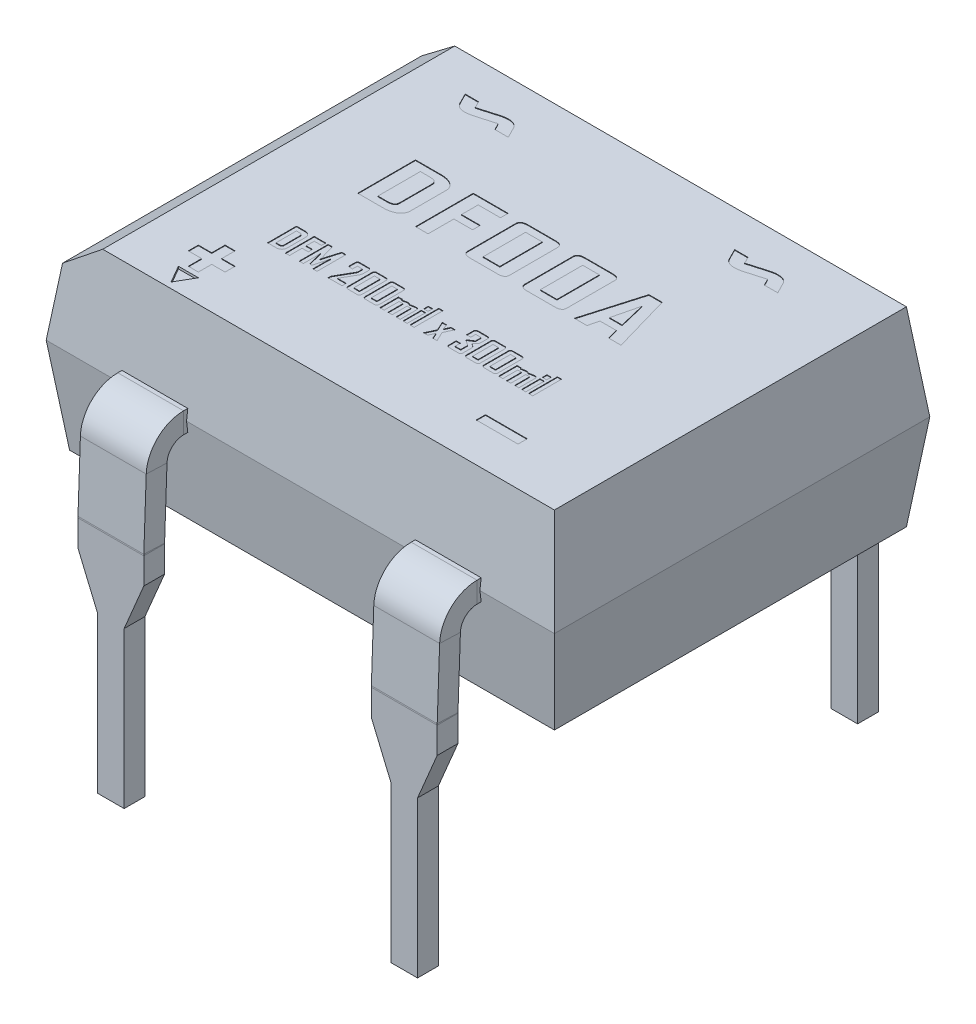
from build123d import *
from OCP.BRepFilletAPI import BRepFilletAPI_MakeChamfer

# Parameters (mm, degrees)
BODY_SKETCH_W                              = 8.8
BODY_SKETCH_H                              = 6.5
BODY_MAIN_DEPTH                            = 3.3
BODY_CHAMFER1_SIZE                         = 1.65
BODY_CHAMFER1_SIZE2                        = 0.202594525
BODY_CHAMFER2_SIZE                         = 0.202594525
BODY_CHAMFER2_SIZE_2                       = 1.65
BODY_CHAMFER_SIZE                          = 0.5
BODY_CHAMFER_SIZE2                         = 0.574265899
PIN_B1_SWEEP_START                         = -0.57
PIN_B1_SWEEP_DEPTH                         = 1.14
PIN_B1_CUT_REACH                           = 12.98
PIN_B_SKETCH_W                             = 0.46
PIN_B_SKETCH_H                             = 0.36
PIN_STRAIGHT_PATTERN_COUNT                 = 2
PIN_STRAIGHT_PATTERN_PITCH                 = 5.08
PIN_STRAIGHT_PATTERN_MIRROR_START          = -0.57
PIN_STRAIGHT_PATTERN_MIRROR_COPY_1_DEPTH   = 1.14
PIN_STRAIGHT_PATTERN_MIRROR_COPY_2_REACH   = 12.98
PIN_STRAIGHT_PATTERN_MIRROR_COPY_3_SKETC_W = 0.46
PIN_STRAIGHT_PATTERN_MIRROR_COPY_3_SKETC_H = 0.36
TEXT_START                                 = 4.56
TEXT_2_OUTLINE_W                           = 0.096385542
TEXT_2_OUTLINE_H                           = 0.355421687
TEXT_2_OUTLINE_W_2                         = 0.289156627
TEXT_2_OUTLINE_H_2                         = 0.73493976
TEXT_2_OUTLINE_W_3                         = 0.289156626
TEXT_2_OUTLINE_W_4                         = 0.072289156
TEXT_2_OUTLINE_H_3                         = 0.319277108
TEXT_2_OUTLINE_W_5                         = 0.072289157
TEXT_2_OUTLINE_H_4                         = 0.5
TEXT_2_OUTLINE_W_6                         = 0.073606928
TEXT_2_OUTLINE_H_5                         = 0.078313253
TEXT_2_OUTLINE_W_7                         = 0.073606927
TEXT_2_DEPTH                               = 0.01
SKETCH23_W                                 = 0.722891566
SKETCH23_H                                 = 0.159036145
TEXT1_DEPTH                                = 0.01
PIN1_MARK_DEPTH                            = 0.04


# Read off the part's stored shape, not the designer's step: PIN_B1_Sweep, text
with BuildPart() as part:
    # BODY_Sketch → BODY_MAIN (new body)
    with BuildSketch(Plane(origin=(0, 1.27, 0), x_dir=(1, 0, 0), z_dir=(0, 1, 0))):
        with Locations((2.54, 3.81)):
            Rectangle(BODY_SKETCH_W, BODY_SKETCH_H)
    extrude(amount=BODY_MAIN_DEPTH)

    # BODY_Chamfer1: one chamfer whose edges measure the first distance from different faces: ONE call of the kernel's chamfer builder (chamfer() names one face for all edges)
    body_chamfer1_edges_1 = [part.edges().sort_by_distance(p)[0] for p in [
        (6.94, 4.57, -3.81),
    ]]
    body_chamfer1_side_1 = [part.faces().sort_by_distance(p)[0] for p in [
        (6.94, 2.92, -3.81),
    ]]
    body_chamfer1_edges_2 = [part.edges().sort_by_distance(p)[0] for p in [
        (2.54, 4.57, -7.06),
    ]]
    body_chamfer1_side_2 = [part.faces().sort_by_distance(p)[0] for p in [
        (2.54, 2.92, -7.06),
    ]]
    body_chamfer1_edges_3 = [part.edges().sort_by_distance(p)[0] for p in [
        (-1.86, 4.57, -3.81),
    ]]
    body_chamfer1_side_3 = [part.faces().sort_by_distance(p)[0] for p in [
        (-1.86, 2.92, -3.81),
    ]]
    body_chamfer1_edges_4 = [part.edges().sort_by_distance(p)[0] for p in [
        (2.54, 4.57, -0.56),
    ]]
    body_chamfer1_side_4 = [part.faces().sort_by_distance(p)[0] for p in [
        (2.54, 2.92, -0.56),
    ]]
    body_chamfer1 = BRepFilletAPI_MakeChamfer(part.part.solid().wrapped)
    for e in body_chamfer1_edges_1:
        body_chamfer1.Add(BODY_CHAMFER1_SIZE, BODY_CHAMFER1_SIZE2, e.wrapped, body_chamfer1_side_1[0].wrapped)  # the first distance lies on this face
    for e in body_chamfer1_edges_2:
        body_chamfer1.Add(BODY_CHAMFER1_SIZE, BODY_CHAMFER1_SIZE2, e.wrapped, body_chamfer1_side_2[0].wrapped)  # the first distance lies on this face
    for e in body_chamfer1_edges_3:
        body_chamfer1.Add(BODY_CHAMFER1_SIZE, BODY_CHAMFER1_SIZE2, e.wrapped, body_chamfer1_side_3[0].wrapped)  # the first distance lies on this face
    for e in body_chamfer1_edges_4:
        body_chamfer1.Add(BODY_CHAMFER1_SIZE, BODY_CHAMFER1_SIZE2, e.wrapped, body_chamfer1_side_4[0].wrapped)  # the first distance lies on this face
    add(Compound.cast(body_chamfer1.Shape()), mode=Mode.REPLACE)

    # BODY_Chamfer2
    # the kernel refuses this chamfer: 1.65, 0.202594525 mm, written as the material it takes off along each edge
    with BuildSketch(Plane(origin=(11.228817255, 1.27, -0.56), x_dir=(0, -0.29696840376135814, -0.9548873060039237), z_dir=(-1, 0, 0))) as body_chamfer2_piece_1:
        Polygon((BODY_CHAMFER2_SIZE * 0.954887308312, -BODY_CHAMFER2_SIZE * 0.296968404479), (-BODY_CHAMFER2_SIZE_2 * 0.296968403761, -BODY_CHAMFER2_SIZE_2 * 0.954887306004), (0, 0), align=None)
    extrude(amount=17.37763451, mode=Mode.SUBTRACT)
    with BuildSketch(Plane(origin=(6.94, 1.27, -11.348817255), x_dir=(-0.9548873060039239, -0.2969684037613571, 0), z_dir=(0, 0, 1))) as body_chamfer2_piece_2:
        Polygon((BODY_CHAMFER2_SIZE * 0.954887308312, -BODY_CHAMFER2_SIZE * 0.296968404479), (-BODY_CHAMFER2_SIZE_2 * 0.296968403761, -BODY_CHAMFER2_SIZE_2 * 0.954887306004), (0, 0), align=None)
    extrude(amount=15.07763451, mode=Mode.SUBTRACT)
    with BuildSketch(Plane(origin=(-6.148817255, 1.27, -7.06), x_dir=(0, 0.9999890085715017, -0.004688575069791045), z_dir=(1, 0, 0))) as body_chamfer2_piece_3:
        Polygon((BODY_CHAMFER2_SIZE_2 * 0.999989008572, BODY_CHAMFER2_SIZE_2 * 0.00468857506979), (-BODY_CHAMFER2_SIZE * 0.00468857508113, BODY_CHAMFER2_SIZE * 0.999989010989), (0, 0), align=None)
    extrude(amount=17.37763451, mode=Mode.SUBTRACT)
    with BuildSketch(Plane(origin=(-1.86, 1.27, 3.728817255), x_dir=(-0.004688575069790786, 0.9999890085715017, 0), z_dir=(0, 0, -1))) as body_chamfer2_piece_4:
        Polygon((BODY_CHAMFER2_SIZE_2 * 0.999989008572, BODY_CHAMFER2_SIZE_2 * 0.00468857506979), (-BODY_CHAMFER2_SIZE * 0.00468857508113, BODY_CHAMFER2_SIZE * 0.999989010989), (0, 0), align=None)
    extrude(amount=15.07763451, mode=Mode.SUBTRACT)

    # BODY_Chamfer
    body_chamfer_edges = [part.edges().sort_by_distance(p)[0] for p in [
        (-1.657405475, 4.57, -3.81),
    ]]
    body_chamfer_side = [part.faces().sort_by_distance(p)[0] for p in [
        (-1.759789019, 3.736152945, -3.81),
    ]]
    chamfer(body_chamfer_edges, length=BODY_CHAMFER_SIZE, length2=BODY_CHAMFER_SIZE2, reference=body_chamfer_side[0])

    # PIN_B1_Sweep outline → PIN_B1_Sweep (add)
    with BuildSketch(Plane.YZ.offset(PIN_B1_SWEEP_START)):
        with BuildLine():
            Line((0.01, 0.18), (0.01, -0.18))
            Line((0.01, -0.18), (1.27, -0.18))
            ThreePointArc((1.27, -0.18), (1.27511433, -0.180045414), (1.280227048, -0.180181642))
            Line((1.280227048, -0.180181642), (2.462227048, -0.222181642))
            ThreePointArc((2.462227048, -0.222181642), (2.659231018, -0.310001737), (2.74, -0.51))
            Line((2.74, -0.51), (2.74, -0.582101221))
            Line((2.74, -0.582101221), (2.92, -0.56))
            Line((2.92, -0.56), (3.1, -0.582101221))
            Line((3.1, -0.582101221), (3.1, -0.51))
            ThreePointArc((3.1, -0.51), (2.918269791, -0.060003909), (2.475010859, 0.137591307))
            Line((2.475010859, 0.137591307), (1.293010859, 0.179591307))
            ThreePointArc((1.293010859, 0.179591307), (1.281507244, 0.179897819), (1.27, 0.18))
            Line((1.27, 0.18), (0.01, 0.18))
        make_face()
    pin_b1_sweep = extrude(amount=PIN_B1_SWEEP_DEPTH)

    # Sketch22 → PIN_B1_Cut (cut, up to next)
    with BuildSketch(Plane(origin=(0, 0.099888998, 0.18), x_dir=(1, 0, 0), z_dir=(0, 0, 1)), mode=Mode.PRIVATE) as pin_b1_cut_sk1:
        Polygon((-0.23, -0.089888998), (-0.67, 0.954152422), (-0.67, -0.089888998), align=None)
    pin_b1_cut_tool1 = extrude(pin_b1_cut_sk1.sketch, amount=-PIN_B1_CUT_REACH, mode=Mode.PRIVATE) & part.part
    # Sketch22 → PIN_B1_Cut (cut, up to next)
    with BuildSketch(Plane(origin=(0, 0.099888998, 0.18), x_dir=(1, 0, 0), z_dir=(0, 0, 1)), mode=Mode.PRIVATE) as pin_b1_cut_sk2:
        Polygon((0.67, -0.089888998), (0.23, -0.089888998), (0.67, 0.954152422), align=None)
    pin_b1_cut_tool2 = extrude(pin_b1_cut_sk2.sketch, amount=-PIN_B1_CUT_REACH, mode=Mode.PRIVATE) & part.part
    pin_b1_cut_1 = pin_b1_cut_tool1.solids().sort_by_distance((-0.523333, 0.358014, 0.18))[0]
    add(pin_b1_cut_1, mode=Mode.SUBTRACT)
    pin_b1_cut_2 = pin_b1_cut_tool2.solids().sort_by_distance((0.523333, 0.358014, 0.18))[0]
    add(pin_b1_cut_2, mode=Mode.SUBTRACT)
    pin_b1_cut = pin_b1_cut_1 + pin_b1_cut_2  # PIN_B1_Cut as one shape, for the pattern or mirror that repeats it

    # PIN_straight: sweep along a path in PIN_B_Path
    with BuildLine(Plane(origin=(0, 0, 0), x_dir=(0, 0, -1), z_dir=(1, 0, 0))) as pin_straight_path:
        Line((0, 0.01), (0, -2.69))
    # PIN_B_Sketch → PIN_straight (sweep)
    with BuildSketch(Plane.XZ.offset(-0.01)):
        Rectangle(PIN_B_SKETCH_W, PIN_B_SKETCH_H)
    pin_straight = sweep(path=pin_straight_path.line)

    # PIN_straight_Pattern: PIN_B1_Sweep, PIN_B1_Cut, PIN_straight ×2
    with Locations(*[(i * PIN_STRAIGHT_PATTERN_PITCH, 0, 0) for i in range(1, PIN_STRAIGHT_PATTERN_COUNT)]):
        add(pin_b1_sweep)
        add(pin_b1_cut, mode=Mode.SUBTRACT)
        add(pin_straight)

    # PIN_straight_Pattern_Mirror: PIN_B1_Sweep, PIN_B1_Cut, PIN_straight across plane
    add(pin_b1_sweep.mirror(Plane.XY.offset(-3.81)))
    add(pin_b1_cut.mirror(Plane.XY.offset(-3.81)), mode=Mode.SUBTRACT)
    add(pin_straight.mirror(Plane.XY.offset(-3.81)))

    # PIN_straight_Pattern_Mirror copy 1 sketc → PIN_straight_Pattern_Mirror copy 1 (add)
    with BuildSketch(Plane(origin=(5.08, 0, -7.62), x_dir=(0, 1, 0), z_dir=(1, 0, 0)).offset(PIN_STRAIGHT_PATTERN_MIRROR_START)):
        with BuildLine():
            Line((0.01, -0.18), (0.01, 0.18))
            Line((0.01, 0.18), (1.27, 0.18))
            ThreePointArc((1.27, 0.18), (1.27511433, 0.180045414), (1.280227048, 0.180181642))
            Line((1.280227048, 0.180181642), (2.462227048, 0.222181642))
            ThreePointArc((2.462227048, 0.222181642), (2.659231018, 0.310001737), (2.74, 0.51))
            Line((2.74, 0.51), (2.74, 0.582101221))
            Line((2.74, 0.582101221), (2.92, 0.56))
            Line((2.92, 0.56), (3.1, 0.582101221))
            Line((3.1, 0.582101221), (3.1, 0.51))
            ThreePointArc((3.1, 0.51), (2.918269791, 0.060003909), (2.475010859, -0.137591307))
            Line((2.475010859, -0.137591307), (1.293010859, -0.179591307))
            ThreePointArc((1.293010859, -0.179591307), (1.281507244, -0.179897819), (1.27, -0.18))
            Line((1.27, -0.18), (0.01, -0.18))
        make_face()
    extrude(amount=PIN_STRAIGHT_PATTERN_MIRROR_COPY_1_DEPTH)

    # PIN_straight_Pattern_Mirror copy 2 sketc → PIN_straight_Pattern_Mirror copy 2 (cut, up to next)
    with BuildSketch(Plane(origin=(5.08, 0.099888998, -7.8), x_dir=(1, 0, 0), z_dir=(0, 0, -1)), mode=Mode.PRIVATE) as pin_straight_pattern_mirror_copy_2_sk1:
        Polygon((-0.23, 0.089888998), (-0.67, -0.954152422), (-0.67, 0.089888998), align=None)
    pin_straight_pattern_mirror_copy_2_tool1 = extrude(pin_straight_pattern_mirror_copy_2_sk1.sketch, amount=-PIN_STRAIGHT_PATTERN_MIRROR_COPY_2_REACH, mode=Mode.PRIVATE) & part.part
    # PIN_straight_Pattern_Mirror copy 2 sketc → PIN_straight_Pattern_Mirror copy 2 (cut, up to next)
    with BuildSketch(Plane(origin=(5.08, 0.099888998, -7.8), x_dir=(1, 0, 0), z_dir=(0, 0, -1)), mode=Mode.PRIVATE) as pin_straight_pattern_mirror_copy_2_sk2:
        Polygon((0.67, 0.089888998), (0.23, 0.089888998), (0.67, -0.954152422), align=None)
    pin_straight_pattern_mirror_copy_2_tool2 = extrude(pin_straight_pattern_mirror_copy_2_sk2.sketch, amount=-PIN_STRAIGHT_PATTERN_MIRROR_COPY_2_REACH, mode=Mode.PRIVATE) & part.part
    add(pin_straight_pattern_mirror_copy_2_tool1.solids().sort_by_distance((4.556667, 0.358014, -7.8))[0], mode=Mode.SUBTRACT)
    add(pin_straight_pattern_mirror_copy_2_tool2.solids().sort_by_distance((5.603333, 0.358014, -7.8))[0], mode=Mode.SUBTRACT)

    # PIN_straight_Pattern_Mirror copy 3: sweep along a path in PIN_straight_Pattern_Mirror copy 3 path
    with BuildLine(Plane(origin=(5.08, 0, -7.62), x_dir=(0, 0, 1), z_dir=(1, 0, 0))) as pin_straight_pattern_mirror_copy_3_path:
        Line((0, -0.01), (0, 2.69))
    # PIN_straight_Pattern_Mirror copy 3 sketc → PIN_straight_Pattern_Mirror copy 3 (sweep)
    with BuildSketch(Plane(origin=(5.08, 0.01, -7.62), x_dir=(1, 0, 0), z_dir=(0, -1, 0))):
        Rectangle(PIN_STRAIGHT_PATTERN_MIRROR_COPY_3_SKETC_W, PIN_STRAIGHT_PATTERN_MIRROR_COPY_3_SKETC_H)
    sweep(path=pin_straight_pattern_mirror_copy_3_path.line)

    # text 2 outline → text 2 (cut)
    # profile 1 of 23: a face of its own
    with BuildSketch(Plane(origin=(0, 0, 0), x_dir=(1, 0, 0), z_dir=(0, 1, 0)).offset(TEXT_START)):
        with BuildLine():
            add(Edge.make_bspline(
                [(1.00746988, 4.002771084), (1.00727965, 3.995663386), (1.006906731, 3.981729721), (1.00317158, 3.961369018), (0.997257124, 3.942069177), (0.988493865, 3.923983479), (0.977882575, 3.906738605), (0.964407588, 3.890821192), (0.948747474, 3.87593042), (0.930816326, 3.862302098), (0.911153939, 3.849767265), (0.889500976, 3.839471181), (0.866749783, 3.829996674), (0.842272775, 3.822856561), (0.816473446, 3.816847302), (0.789045864, 3.813186314), (0.760229918, 3.810276646), (0.740472688, 3.810093652), (0.730361446, 3.81)],
                knots=[0, 0, 0, 0, 0.056495464, 0.110751584, 0.164123021, 0.216604362, 0.270213453, 0.324803911, 0.382011829, 0.44182685, 0.503744729, 0.567156209, 0.632331663, 0.699614706, 0.769742039, 0.842889516, 0.919594889, 1, 1, 1, 1], degree=3))
            Line((1.00746988, 4.002771084), (1.00746988, 4.617228916))
            add(Edge.make_bspline(
                [(0.730361446, 4.81), (0.740471168, 4.809897591), (0.760225426, 4.809697486), (0.789071712, 4.806908855), (0.816419765, 4.802815582), (0.842342516, 4.797284539), (0.866701964, 4.789725064), (0.889560961, 4.780407473), (0.911100603, 4.769810429), (0.930827976, 4.757339937), (0.948730267, 4.743677753), (0.964496894, 4.72881004), (0.977685611, 4.712749031), (0.988673159, 4.695745528), (0.99714848, 4.67763104), (1.003218162, 4.658397882), (1.006885969, 4.638140232), (1.007273205, 4.624272342), (1.00746988, 4.617228916)],
                knots=[0, 0, 0, 0, 0.080457372, 0.157212601, 0.230480895, 0.300545247, 0.36801829, 0.433236106, 0.496910647, 0.558868771, 0.618722669, 0.675967771, 0.73097843, 0.783778264, 0.836745638, 0.889675303, 0.943966688, 1, 1, 1, 1], degree=3))
            Line((0.730361446, 4.81), (0.284578313, 4.81))
            Line((0.284578313, 4.81), (0.284578313, 3.81))
            Line((0.284578313, 3.81), (0.730361446, 3.81))
        make_face()
        with BuildLine():
            add(Edge.make_bspline(
                [(0.657695783, 3.94253012), (0.668063216, 3.942752359), (0.687566079, 3.943170426), (0.7147746, 3.946996071), (0.738004617, 3.953460748), (0.757166303, 3.962570736), (0.772428504, 3.974474531), (0.783047639, 3.989475426), (0.789611002, 4.007155894), (0.790261483, 4.019841986), (0.79060241, 4.026490964)],
                knots=[0, 0, 0, 0, 0.175147659, 0.329481845, 0.463068675, 0.581170952, 0.686015021, 0.786369893, 0.888033156, 1, 1, 1, 1], degree=3))
            Line((0.657695783, 3.94253012), (0.501445783, 3.94253012))
            Line((0.501445783, 3.94253012), (0.501445783, 4.67746988))
            Line((0.501445783, 4.67746988), (0.66315512, 4.67746988))
            add(Edge.make_bspline(
                [(0.79060241, 4.594638554), (0.790206584, 4.601144228), (0.789447018, 4.61362824), (0.783581123, 4.631196527), (0.773071586, 4.645834918), (0.758671488, 4.657749996), (0.740191612, 4.666726383), (0.717999514, 4.673194022), (0.691821362, 4.676783029), (0.673143617, 4.677230552), (0.66315512, 4.67746988)],
                knots=[0, 0, 0, 0, 0.11341682, 0.217640324, 0.318193179, 0.423895753, 0.540435318, 0.674148639, 0.825741007, 1, 1, 1, 1], degree=3))
            Line((0.79060241, 4.594638554), (0.79060241, 4.026490964))
        make_face(mode=Mode.SUBTRACT)
    # profile 2 of 23: a face of its own
    with BuildSketch(Plane(origin=(0, 0, 0), x_dir=(1, 0, 0), z_dir=(0, 1, 0)).offset(TEXT_START)):
        with BuildLine():
            add(Edge.make_bspline(
                [(3.892409639, 2.325736269), (3.89219699, 2.322740065), (3.891795344, 2.317080916), (3.889664259, 2.309191369), (3.886537296, 2.302330064), (3.881927287, 2.296779615), (3.876376838, 2.292169605), (3.869515532, 2.289042642), (3.861625986, 2.286911557), (3.855966836, 2.286509912), (3.852970633, 2.286297263)],
                knots=[0, 0, 0, 0, 0.143087679, 0.270260174, 0.38817721, 0.5, 0.61182279, 0.729739826, 0.856912321, 1, 1, 1, 1], degree=3))
            Line((3.892409639, 2.325736269), (3.892409639, 2.746858257))
            add(Edge.make_bspline(
                [(3.852970633, 2.786297263), (3.855966836, 2.786084614), (3.861625986, 2.785682968), (3.869515532, 2.783551883), (3.876376838, 2.780424921), (3.881927287, 2.775814911), (3.886537296, 2.770264462), (3.889664259, 2.763403156), (3.891795344, 2.75551361), (3.89219699, 2.74985446), (3.892409639, 2.746858257)],
                knots=[0, 0, 0, 0, 0.143087679, 0.270260174, 0.38817721, 0.5, 0.61182279, 0.729739826, 0.856912321, 1, 1, 1, 1], degree=3))
            Line((3.852970633, 2.786297263), (3.691920181, 2.786297263))
            add(Edge.make_bspline(
                [(3.651445783, 2.746858257), (3.651649223, 2.749856632), (3.652034038, 2.755528188), (3.65429028, 2.763411133), (3.657508196, 2.770274575), (3.662216952, 2.77581752), (3.667879218, 2.780452518), (3.674940455, 2.78356486), (3.683050815, 2.785670101), (3.688862192, 2.786081029), (3.691920181, 2.786297263)],
                knots=[0, 0, 0, 0, 0.141223278, 0.267129934, 0.384156657, 0.495459119, 0.606977379, 0.726031612, 0.85583585, 1, 1, 1, 1], degree=3))
            Line((3.651445783, 2.746858257), (3.651445783, 2.325736269))
            add(Edge.make_bspline(
                [(3.690884789, 2.286297263), (3.687888585, 2.286509912), (3.682229436, 2.286911557), (3.67433989, 2.289042642), (3.667478584, 2.292169605), (3.661928135, 2.296779615), (3.657318125, 2.302330064), (3.654191163, 2.309191369), (3.652060078, 2.317080916), (3.651658432, 2.322740065), (3.651445783, 2.325736269)],
                knots=[0, 0, 0, 0, 0.143087679, 0.270260174, 0.38817721, 0.5, 0.61182279, 0.729739826, 0.856912321, 1, 1, 1, 1], degree=3))
            Line((3.690884789, 2.286297263), (3.852970633, 2.286297263))
        make_face()
        with Locations((3.771927711, 2.536297263)):
            Rectangle(TEXT_2_OUTLINE_W, TEXT_2_OUTLINE_H, mode=Mode.SUBTRACT)
    # profile 3 of 23: a face of its own
    with BuildSketch(Plane(origin=(0, 0, 0), x_dir=(1, 0, 0), z_dir=(0, 1, 0)).offset(TEXT_START)):
        with BuildLine():
            add(Edge.make_bspline(
                [(4.193614458, 2.325736269), (4.193401809, 2.322740065), (4.193000163, 2.317080916), (4.190869078, 2.309191369), (4.187742116, 2.302330064), (4.183132106, 2.296779615), (4.177581657, 2.292169605), (4.170720351, 2.289042642), (4.162830805, 2.286911557), (4.157171656, 2.286509912), (4.154175452, 2.286297263)],
                knots=[0, 0, 0, 0, 0.143087679, 0.270260174, 0.38817721, 0.5, 0.61182279, 0.729739826, 0.856912321, 1, 1, 1, 1], degree=3))
            Line((4.193614458, 2.325736269), (4.193614458, 2.746858257))
            add(Edge.make_bspline(
                [(4.154175452, 2.786297263), (4.157171656, 2.786084614), (4.162830805, 2.785682968), (4.170720351, 2.783551883), (4.177581657, 2.780424921), (4.183132106, 2.775814911), (4.187742116, 2.770264462), (4.190869078, 2.763403156), (4.193000163, 2.75551361), (4.193401809, 2.74985446), (4.193614458, 2.746858257)],
                knots=[0, 0, 0, 0, 0.143087679, 0.270260174, 0.38817721, 0.5, 0.61182279, 0.729739826, 0.856912321, 1, 1, 1, 1], degree=3))
            Line((4.154175452, 2.786297263), (3.993125, 2.786297263))
            add(Edge.make_bspline(
                [(3.952650602, 2.746858257), (3.952854042, 2.749856632), (3.953238858, 2.755528188), (3.955495099, 2.763411133), (3.958713015, 2.770274575), (3.963421771, 2.77581752), (3.969084037, 2.780452518), (3.976145275, 2.78356486), (3.984255634, 2.785670101), (3.990067011, 2.786081029), (3.993125, 2.786297263)],
                knots=[0, 0, 0, 0, 0.141223278, 0.267129934, 0.384156657, 0.495459119, 0.606977379, 0.726031612, 0.85583585, 1, 1, 1, 1], degree=3))
            Line((3.952650602, 2.746858257), (3.952650602, 2.325736269))
            add(Edge.make_bspline(
                [(3.992089608, 2.286297263), (3.989093405, 2.286509912), (3.983434255, 2.286911557), (3.975544709, 2.289042642), (3.968683403, 2.292169605), (3.963132954, 2.296779615), (3.958522945, 2.302330064), (3.955395982, 2.309191369), (3.953264897, 2.317080916), (3.952863251, 2.322740065), (3.952650602, 2.325736269)],
                knots=[0, 0, 0, 0, 0.143087679, 0.270260174, 0.38817721, 0.5, 0.61182279, 0.729739826, 0.856912321, 1, 1, 1, 1], degree=3))
            Line((3.992089608, 2.286297263), (4.154175452, 2.286297263))
        make_face()
        with Locations((4.07313253, 2.536297263)):
            Rectangle(TEXT_2_OUTLINE_W, TEXT_2_OUTLINE_H, mode=Mode.SUBTRACT)
    # profile 4 of 23: a face of its own
    with BuildSketch(Plane(origin=(0, 0, 0), x_dir=(1, 0, 0), z_dir=(0, 1, 0)).offset(TEXT_START)):
        with BuildLine():
            add(Edge.make_bspline(
                [(4.320120482, 2.589008106), (4.328121599, 2.590763482), (4.344093901, 2.594267667), (4.360061857, 2.597791607), (4.368030873, 2.599550275)],
                knots=[0, 0, 0, 0, 0.500936953, 1, 1, 1, 1], degree=3))
            Line((4.320120482, 2.589008106), (4.320120482, 2.605574371))
            Line((4.320120482, 2.605574371), (4.247831325, 2.605574371))
            Line((4.247831325, 2.605574371), (4.247831325, 2.286297263))
            Line((4.247831325, 2.286297263), (4.320120482, 2.286297263))
            Line((4.320120482, 2.286297263), (4.320120482, 2.544580395))
            Line((4.320120482, 2.544580395), (4.386385542, 2.545333407))
            Line((4.386385542, 2.545333407), (4.386385542, 2.286297263))
            Line((4.386385542, 2.286297263), (4.458674699, 2.286297263))
            Line((4.458674699, 2.286297263), (4.458674699, 2.544580395))
            Line((4.458674699, 2.544580395), (4.524939759, 2.545333407))
            Line((4.524939759, 2.545333407), (4.524939759, 2.286297263))
            Line((4.524939759, 2.286297263), (4.597228916, 2.286297263))
            Line((4.597228916, 2.286297263), (4.597228916, 2.566135365))
            add(Edge.make_bspline(
                [(4.555060241, 2.605574371), (4.558302555, 2.605424039), (4.564445324, 2.605139226), (4.573037835, 2.603188079), (4.580364374, 2.59995643), (4.586465373, 2.595582266), (4.591258254, 2.589898854), (4.594631855, 2.582982184), (4.596702683, 2.574909584), (4.597047491, 2.56916037), (4.597228916, 2.566135365)],
                knots=[0, 0, 0, 0, 0.148290832, 0.280946377, 0.400455298, 0.512425211, 0.621411208, 0.736958176, 0.861597969, 1, 1, 1, 1], degree=3))
            add(Edge.make_bspline(
                [(4.503196536, 2.598420757), (4.508492417, 2.599492064), (4.518429967, 2.601502338), (4.532394128, 2.603778123), (4.544394919, 2.605207154), (4.551731522, 2.60545976), (4.555060241, 2.605574371)],
                knots=[0, 0, 0, 0, 0.309141697, 0.580094407, 0.809483008, 1, 1, 1, 1], degree=3))
            add(Edge.make_bspline(
                [(4.451991717, 2.587690335), (4.460528998, 2.589432357), (4.477616171, 2.592918976), (4.494665553, 2.596585928), (4.503196536, 2.598420757)],
                knots=[0, 0, 0, 0, 0.499630991, 1, 1, 1, 1], degree=3))
            add(Edge.make_bspline(
                [(4.416506024, 2.605574371), (4.418705136, 2.60552566), (4.422901708, 2.605432704), (4.428903765, 2.604583893), (4.434265507, 2.603174599), (4.439101401, 2.60132216), (4.443284232, 2.598735824), (4.446869791, 2.595620963), (4.449935465, 2.591978881), (4.451297409, 2.589138393), (4.451991717, 2.587690335)],
                knots=[0, 0, 0, 0, 0.156222728, 0.298120382, 0.429540729, 0.5496141, 0.664719661, 0.776938378, 0.886284968, 1, 1, 1, 1], degree=3))
            add(Edge.make_bspline(
                [(4.368030873, 2.599550275), (4.372667227, 2.600470571), (4.38153478, 2.60223074), (4.394288656, 2.604086271), (4.405814195, 2.605321613), (4.413083446, 2.60549346), (4.416506024, 2.605574371)],
                knots=[0, 0, 0, 0, 0.289803378, 0.554281819, 0.790142707, 1, 1, 1, 1], degree=3))
        make_face()
    # profile 5 of 23: a face of its own
    with BuildSketch(Plane(origin=(0, 0, 0), x_dir=(1, 0, 0), z_dir=(0, 1, 0)).offset(TEXT_START)):
        with BuildLine():
            add(Edge.make_bspline(
                [(2.829156627, 3.888878012), (2.828646766, 3.882852243), (2.827668852, 3.871294821), (2.821259099, 3.855326841), (2.811720935, 3.841493213), (2.79812027, 3.830496657), (2.781438069, 3.821510148), (2.761151229, 3.8153725), (2.737575188, 3.811226258), (2.720680382, 3.810426002), (2.711686747, 3.81)],
                knots=[0, 0, 0, 0, 0.114098337, 0.218840581, 0.322174175, 0.429434412, 0.547100708, 0.679564678, 0.829422238, 1, 1, 1, 1], degree=3))
            Line((2.829156627, 3.888878012), (2.829156627, 4.731121988))
            add(Edge.make_bspline(
                [(2.711686747, 4.81), (2.720680382, 4.809573998), (2.737575188, 4.808773742), (2.761151229, 4.8046275), (2.781438069, 4.798489852), (2.79812027, 4.789503343), (2.811720935, 4.778506787), (2.821259099, 4.764673159), (2.827668852, 4.748705179), (2.828646766, 4.737147757), (2.829156627, 4.731121988)],
                knots=[0, 0, 0, 0, 0.170577762, 0.320435322, 0.452899292, 0.570565588, 0.677825825, 0.781159419, 0.885901663, 1, 1, 1, 1], degree=3))
            Line((2.711686747, 4.81), (2.226558735, 4.81))
            add(Edge.make_bspline(
                [(2.10626506, 4.731121988), (2.106757854, 4.737154091), (2.107704926, 4.748746842), (2.114377579, 4.764683097), (2.124096299, 4.778582684), (2.138089706, 4.789496459), (2.155125555, 4.798486553), (2.1759007, 4.804672818), (2.200050899, 4.808747761), (2.217378495, 4.809566322), (2.226558735, 4.81)],
                knots=[0, 0, 0, 0, 0.112348161, 0.215915455, 0.318343111, 0.425762474, 0.543690884, 0.676356302, 0.828532073, 1, 1, 1, 1], degree=3))
            Line((2.10626506, 4.731121988), (2.10626506, 3.888878012))
            add(Edge.make_bspline(
                [(2.22373494, 3.81), (2.214741305, 3.810426002), (2.197846499, 3.811226258), (2.174270458, 3.8153725), (2.153983618, 3.821510148), (2.137301417, 3.830496657), (2.123700751, 3.841493213), (2.114162588, 3.855326841), (2.107752834, 3.871294821), (2.106774921, 3.882852243), (2.10626506, 3.888878012)],
                knots=[0, 0, 0, 0, 0.170577762, 0.320435322, 0.452899292, 0.570565588, 0.677825825, 0.781159419, 0.885901663, 1, 1, 1, 1], degree=3))
            Line((2.22373494, 3.81), (2.711686747, 3.81))
        make_face()
        with Locations((2.467710843, 4.31)):
            Rectangle(TEXT_2_OUTLINE_W_2, TEXT_2_OUTLINE_H_2, mode=Mode.SUBTRACT)
    # profile 6 of 23: a face of its own
    with BuildSketch(Plane(origin=(0, 0, 0), x_dir=(1, 0, 0), z_dir=(0, 1, 0)).offset(TEXT_START)):
        with BuildLine():
            add(Edge.make_bspline(
                [(3.818313253, 3.888878012), (3.817803392, 3.882852243), (3.816825479, 3.871294821), (3.810415725, 3.855326841), (3.800877562, 3.841493213), (3.787276896, 3.830496657), (3.770594696, 3.821510148), (3.750307856, 3.8153725), (3.726731814, 3.811226258), (3.709837008, 3.810426002), (3.700843373, 3.81)],
                knots=[0, 0, 0, 0, 0.114098337, 0.218840581, 0.322174175, 0.429434412, 0.547100708, 0.679564678, 0.829422238, 1, 1, 1, 1], degree=3))
            Line((3.818313253, 3.888878012), (3.818313253, 4.731121988))
            add(Edge.make_bspline(
                [(3.700843373, 4.81), (3.709837008, 4.809573998), (3.726731814, 4.808773742), (3.750307856, 4.8046275), (3.770594696, 4.798489852), (3.787276896, 4.789503343), (3.800877562, 4.778506787), (3.810415725, 4.764673159), (3.816825479, 4.748705179), (3.817803392, 4.737147757), (3.818313253, 4.731121988)],
                knots=[0, 0, 0, 0, 0.170577762, 0.320435322, 0.452899292, 0.570565588, 0.677825825, 0.781159419, 0.885901663, 1, 1, 1, 1], degree=3))
            Line((3.700843373, 4.81), (3.215715361, 4.81))
            add(Edge.make_bspline(
                [(3.095421687, 4.731121988), (3.095914481, 4.737154091), (3.096861553, 4.748746842), (3.103534206, 4.764683097), (3.113252925, 4.778582684), (3.127246332, 4.789496459), (3.144282182, 4.798486553), (3.165057327, 4.804672818), (3.189207526, 4.808747761), (3.206535121, 4.809566322), (3.215715361, 4.81)],
                knots=[0, 0, 0, 0, 0.112348161, 0.215915455, 0.318343111, 0.425762474, 0.543690884, 0.676356302, 0.828532073, 1, 1, 1, 1], degree=3))
            Line((3.095421687, 4.731121988), (3.095421687, 3.888878012))
            add(Edge.make_bspline(
                [(3.212891566, 3.81), (3.203897932, 3.810426002), (3.187003125, 3.811226258), (3.163427084, 3.8153725), (3.143140244, 3.821510148), (3.126458044, 3.830496657), (3.112857378, 3.841493213), (3.103319214, 3.855326841), (3.096909461, 3.871294821), (3.095931548, 3.882852243), (3.095421687, 3.888878012)],
                knots=[0, 0, 0, 0, 0.170577762, 0.320435322, 0.452899292, 0.570565588, 0.677825825, 0.781159419, 0.885901663, 1, 1, 1, 1], degree=3))
            Line((3.212891566, 3.81), (3.700843373, 3.81))
        make_face()
        with Locations((3.45686747, 4.31)):
            Rectangle(TEXT_2_OUTLINE_W_3, TEXT_2_OUTLINE_H_2, mode=Mode.SUBTRACT)
    # profile 7 of 23: a face of its own
    with BuildSketch(Plane(origin=(0, 0, 0), x_dir=(1, 0, 0), z_dir=(0, 1, 0)).offset(TEXT_START)):
        with BuildLine():
            add(Edge.make_bspline(
                [(0.494819277, 2.382682805), (0.494769873, 2.379132009), (0.49467332, 2.372192421), (0.49324744, 2.362066521), (0.491271374, 2.352460355), (0.488271159, 2.343398519), (0.484573473, 2.334840077), (0.479871465, 2.326857229), (0.474417787, 2.319382197), (0.468089164, 2.312553349), (0.461204923, 2.306333627), (0.453622877, 2.301046903), (0.445703742, 2.29639948), (0.437179156, 2.292736283), (0.428226756, 2.28973493), (0.41869126, 2.287909107), (0.408738678, 2.286433068), (0.401922562, 2.286343241), (0.398433735, 2.286297263)],
                knots=[0, 0, 0, 0, 0.069353069, 0.135541955, 0.19954334, 0.260836372, 0.321806312, 0.38145378, 0.441566172, 0.502341433, 0.56316001, 0.622554653, 0.682732722, 0.742332868, 0.803625899, 0.866900141, 0.931872869, 1, 1, 1, 1], degree=3))
            Line((0.494819277, 2.382682805), (0.494819277, 2.689911721))
            add(Edge.make_bspline(
                [(0.398433735, 2.786297263), (0.401921555, 2.786247217), (0.408735704, 2.786149442), (0.418708877, 2.78472948), (0.428190041, 2.78269679), (0.437225755, 2.779919916), (0.445672268, 2.776061618), (0.453659203, 2.771477438), (0.461172707, 2.766057987), (0.468095639, 2.75986095), (0.474410716, 2.753019124), (0.479909116, 2.745538815), (0.484491362, 2.737526074), (0.488343765, 2.729037988), (0.491229331, 2.719995269), (0.493265598, 2.710407419), (0.494665411, 2.70033807), (0.494767346, 2.693430705), (0.494819277, 2.689911721)],
                knots=[0, 0, 0, 0, 0.068173051, 0.133189572, 0.196634252, 0.257780977, 0.317670276, 0.377888907, 0.437680628, 0.498540198, 0.559356424, 0.619509332, 0.679727963, 0.739617262, 0.801535392, 0.864980072, 0.931213571, 1, 1, 1, 1], degree=3))
            Line((0.398433735, 2.786297263), (0.247831325, 2.786297263))
            Line((0.247831325, 2.786297263), (0.247831325, 2.286297263))
            Line((0.247831325, 2.286297263), (0.398433735, 2.286297263))
        make_face()
        with BuildLine():
            add(Edge.make_bspline(
                [(0.375466867, 2.358586419), (0.379145856, 2.358707068), (0.386087407, 2.358934708), (0.395809652, 2.360756712), (0.404080954, 2.363941812), (0.410928314, 2.368451667), (0.416244095, 2.374344461), (0.419993425, 2.381561031), (0.422132839, 2.390029746), (0.42239302, 2.396067517), (0.42253012, 2.39924907)],
                knots=[0, 0, 0, 0, 0.155039075, 0.292529262, 0.414853709, 0.526381646, 0.635024854, 0.745670761, 0.865983309, 1, 1, 1, 1], degree=3))
            Line((0.375466867, 2.358586419), (0.320120482, 2.358586419))
            Line((0.320120482, 2.358586419), (0.320120482, 2.714008106))
            Line((0.320120482, 2.714008106), (0.377443524, 2.714008106))
            add(Edge.make_bspline(
                [(0.42253012, 2.674004341), (0.422442059, 2.677158605), (0.422275794, 2.683114019), (0.420022225, 2.691388587), (0.416550428, 2.698528207), (0.411410338, 2.704295886), (0.404867831, 2.708733101), (0.396930075, 2.711820442), (0.387630024, 2.713662611), (0.380966684, 2.713888611), (0.377443524, 2.714008106)],
                knots=[0, 0, 0, 0, 0.136747249, 0.258185866, 0.369828416, 0.479035878, 0.589900655, 0.710478103, 0.846918828, 1, 1, 1, 1], degree=3))
            Line((0.42253012, 2.674004341), (0.42253012, 2.39924907))
        make_face(mode=Mode.SUBTRACT)
    # profile 8 of 23: a face of its own
    with BuildSketch(Plane(origin=(0, 0, 0), x_dir=(1, 0, 0), z_dir=(0, 1, 0)).offset(TEXT_START)):
        with BuildLine():
            add(Edge.make_bspline(
                [(1.030963855, 2.533849974), (1.031026316, 2.537428177), (1.03116288, 2.545251661), (1.032122288, 2.557925851), (1.033372035, 2.572531776), (1.034688607, 2.582862739), (1.035387801, 2.588349221)],
                knots=[0, 0, 0, 0, 0.196205167, 0.428988559, 0.69675201, 1, 1, 1, 1], degree=3))
            Line((1.030963855, 2.533849974), (1.030963855, 2.286297263))
            Line((1.030963855, 2.286297263), (1.103253012, 2.286297263))
            Line((1.103253012, 2.286297263), (1.103253012, 2.786297263))
            Line((1.103253012, 2.786297263), (1.03246988, 2.786297263))
            Line((1.03246988, 2.786297263), (0.951615211, 2.511541992))
            add(Edge.make_bspline(
                [(0.949638554, 2.48895163), (0.94965405, 2.490426914), (0.949687724, 2.493632762), (0.95011186, 2.498875471), (0.950781847, 2.504927376), (0.951326733, 2.50925227), (0.951615211, 2.511541992)],
                knots=[0, 0, 0, 0, 0.194996564, 0.423734939, 0.69490896, 1, 1, 1, 1], degree=3))
            add(Edge.make_bspline(
                [(0.947661898, 2.511541992), (0.947905322, 2.51051034), (0.948518525, 2.507911543), (0.948809132, 2.503067913), (0.9493535, 2.496584904), (0.949536543, 2.491683317), (0.949638554, 2.48895163)],
                knots=[0, 0, 0, 0, 0.139830187, 0.352241267, 0.63899967, 1, 1, 1, 1], degree=3))
            Line((0.947661898, 2.511541992), (0.866807229, 2.786297263))
            Line((0.866807229, 2.786297263), (0.796024096, 2.786297263))
            Line((0.796024096, 2.786297263), (0.796024096, 2.286297263))
            Line((0.796024096, 2.286297263), (0.868313253, 2.286297263))
            Line((0.868313253, 2.286297263), (0.868313253, 2.533849974))
            add(Edge.make_bspline(
                [(0.863795181, 2.588349221), (0.864480627, 2.582767246), (0.865765417, 2.572304492), (0.867168965, 2.557648008), (0.868109154, 2.545063154), (0.868249268, 2.53736531), (0.868313253, 2.533849974)],
                knots=[0, 0, 0, 0, 0.308334773, 0.577937301, 0.807258736, 1, 1, 1, 1], degree=3))
            Line((0.863795181, 2.588349221), (0.930248494, 2.334490034))
            Line((0.930248494, 2.334490034), (0.969310994, 2.334490034))
            Line((0.969310994, 2.334490034), (1.035387801, 2.588349221))
        make_face()
    # profile 9 of 23: a face of its own
    with BuildSketch(Plane(origin=(0, 0, 0), x_dir=(1, 0, 0), z_dir=(0, 1, 0)).offset(TEXT_START)):
        with BuildLine():
            add(Edge.make_bspline(
                [(1.536987952, 2.64924907), (1.536768289, 2.645215571), (1.536311406, 2.636826168), (1.53304336, 2.624032747), (1.528086635, 2.610571335), (1.523361614, 2.601787527), (1.520892319, 2.597197112)],
                knots=[0, 0, 0, 0, 0.219722693, 0.457008212, 0.716232688, 1, 1, 1, 1], degree=3))
            Line((1.536987952, 2.64924907), (1.536987952, 2.746858257))
            add(Edge.make_bspline(
                [(1.497548946, 2.786297263), (1.50054515, 2.786084614), (1.506204299, 2.785682968), (1.514093845, 2.783551883), (1.520955151, 2.780424921), (1.5265056, 2.775814911), (1.53111561, 2.770264462), (1.534242572, 2.763403156), (1.536373657, 2.75551361), (1.536775303, 2.74985446), (1.536987952, 2.746858257)],
                knots=[0, 0, 0, 0, 0.143087679, 0.270260174, 0.38817721, 0.5, 0.61182279, 0.729739826, 0.856912321, 1, 1, 1, 1], degree=3))
            Line((1.497548946, 2.786297263), (1.341487199, 2.786297263))
            add(Edge.make_bspline(
                [(1.302048193, 2.746858257), (1.302260842, 2.74985446), (1.302662487, 2.75551361), (1.304793572, 2.763403156), (1.307920535, 2.770264462), (1.312530545, 2.775814911), (1.318080994, 2.780424921), (1.324942299, 2.783551883), (1.332831846, 2.785682968), (1.338490995, 2.786084614), (1.341487199, 2.786297263)],
                knots=[0, 0, 0, 0, 0.143087679, 0.270260174, 0.38817721, 0.5, 0.61182279, 0.729739826, 0.856912321, 1, 1, 1, 1], degree=3))
            Line((1.302048193, 2.746858257), (1.302048193, 2.629670757))
            Line((1.302048193, 2.629670757), (1.374337349, 2.629670757))
            Line((1.374337349, 2.629670757), (1.374337349, 2.714008106))
            Line((1.374337349, 2.714008106), (1.464698795, 2.714008106))
            Line((1.464698795, 2.714008106), (1.464698795, 2.627599974))
            Line((1.464698795, 2.627599974), (1.296024096, 2.331477986))
            Line((1.296024096, 2.331477986), (1.296024096, 2.286297263))
            Line((1.296024096, 2.286297263), (1.536987952, 2.286297263))
            Line((1.536987952, 2.286297263), (1.536987952, 2.358586419))
            Line((1.536987952, 2.358586419), (1.384973645, 2.358586419))
            Line((1.384973645, 2.358586419), (1.520892319, 2.597197112))
        make_face()
    # profile 10 of 23: a face of its own
    with BuildSketch(Plane(origin=(0, 0, 0), x_dir=(1, 0, 0), z_dir=(0, 1, 0)).offset(TEXT_START)):
        with BuildLine():
            add(Edge.make_bspline(
                [(3.591204819, 2.325736269), (3.59099217, 2.322740065), (3.590590525, 2.317080916), (3.58845944, 2.309191369), (3.585332477, 2.302330064), (3.580722467, 2.296779615), (3.575172018, 2.292169605), (3.568310713, 2.289042642), (3.560421166, 2.286911557), (3.554762017, 2.286509912), (3.551765813, 2.286297263)],
                knots=[0, 0, 0, 0, 0.143087679, 0.270260174, 0.38817721, 0.5, 0.61182279, 0.729739826, 0.856912321, 1, 1, 1, 1], degree=3))
            Line((3.591204819, 2.325736269), (3.591204819, 2.469749823))
            add(Edge.make_bspline(
                [(3.56748494, 2.517283709), (3.569376817, 2.515920698), (3.573089664, 2.513245762), (3.577900202, 2.508438964), (3.582115557, 2.503295015), (3.585414328, 2.497508276), (3.588103457, 2.491310164), (3.589816701, 2.484535442), (3.591018617, 2.477322685), (3.591141425, 2.472328085), (3.591204819, 2.469749823)],
                knots=[0, 0, 0, 0, 0.125819832, 0.24692388, 0.366354479, 0.484136678, 0.605702798, 0.730328692, 0.860793041, 1, 1, 1, 1], degree=3))
            Line((3.56748494, 2.517283709), (3.521645331, 2.548345456))
            Line((3.521645331, 2.548345456), (3.566920181, 2.579971962))
            add(Edge.make_bspline(
                [(3.591204819, 2.628447112), (3.59113758, 2.625901077), (3.591006547, 2.620939518), (3.589835939, 2.613709499), (3.587991592, 2.606935063), (3.585324858, 2.600585582), (3.581769679, 2.594774154), (3.577675651, 2.58922171), (3.572586737, 2.584335915), (3.568830479, 2.581443129), (3.566920181, 2.579971962)],
                knots=[0, 0, 0, 0, 0.135040839, 0.263159402, 0.387589061, 0.506969388, 0.627194466, 0.748418614, 0.872054687, 1, 1, 1, 1], degree=3))
            Line((3.591204819, 2.628447112), (3.591204819, 2.746858257))
            add(Edge.make_bspline(
                [(3.551765813, 2.786297263), (3.554762017, 2.786084614), (3.560421166, 2.785682968), (3.568310713, 2.783551883), (3.575172018, 2.780424921), (3.580722467, 2.775814911), (3.585332477, 2.770264462), (3.58845944, 2.763403156), (3.590590525, 2.75551361), (3.59099217, 2.74985446), (3.591204819, 2.746858257)],
                knots=[0, 0, 0, 0, 0.143087679, 0.270260174, 0.38817721, 0.5, 0.61182279, 0.729739826, 0.856912321, 1, 1, 1, 1], degree=3))
            Line((3.551765813, 2.786297263), (3.390715361, 2.786297263))
            add(Edge.make_bspline(
                [(3.350240964, 2.746858257), (3.350444404, 2.749856632), (3.350829219, 2.755528188), (3.353085461, 2.763411133), (3.356303377, 2.770274575), (3.361012133, 2.77581752), (3.366674399, 2.780452518), (3.373735636, 2.78356486), (3.381845996, 2.785670101), (3.387657373, 2.786081029), (3.390715361, 2.786297263)],
                knots=[0, 0, 0, 0, 0.141223278, 0.267129934, 0.384156657, 0.495459119, 0.606977379, 0.726031612, 0.85583585, 1, 1, 1, 1], degree=3))
            Line((3.350240964, 2.746858257), (3.350240964, 2.629670757))
            Line((3.350240964, 2.629670757), (3.42253012, 2.629670757))
            Line((3.42253012, 2.629670757), (3.42253012, 2.714008106))
            Line((3.42253012, 2.714008106), (3.518915663, 2.714008106))
            Line((3.518915663, 2.714008106), (3.518915663, 2.614704642))
            Line((3.518915663, 2.614704642), (3.428554217, 2.556252082))
            Line((3.428554217, 2.556252082), (3.428554217, 2.540721209))
            Line((3.428554217, 2.540721209), (3.518915663, 2.479915486))
            Line((3.518915663, 2.479915486), (3.518915663, 2.358586419))
            Line((3.518915663, 2.358586419), (3.42253012, 2.358586419))
            Line((3.42253012, 2.358586419), (3.42253012, 2.448947865))
            Line((3.42253012, 2.448947865), (3.350240964, 2.448947865))
            Line((3.350240964, 2.448947865), (3.350240964, 2.325736269))
            add(Edge.make_bspline(
                [(3.38967997, 2.286297263), (3.386683766, 2.286509912), (3.381024617, 2.286911557), (3.37313507, 2.289042642), (3.366273765, 2.292169605), (3.360723316, 2.296779615), (3.356113306, 2.302330064), (3.352986343, 2.309191369), (3.350855258, 2.317080916), (3.350453613, 2.322740065), (3.350240964, 2.325736269)],
                knots=[0, 0, 0, 0, 0.143087679, 0.270260174, 0.38817721, 0.5, 0.61182279, 0.729739826, 0.856912321, 1, 1, 1, 1], degree=3))
            Line((3.38967997, 2.286297263), (3.551765813, 2.286297263))
        make_face()
    # profile 11 of 23: a face of its own
    with BuildSketch(Plane(origin=(0, 0, 0), x_dir=(1, 0, 0), z_dir=(0, 1, 0)).offset(TEXT_START)):
        with BuildLine():
            add(Edge.make_bspline(
                [(2.265903614, 2.589008106), (2.273904731, 2.590763482), (2.289877034, 2.594267667), (2.305844989, 2.597791607), (2.313814006, 2.599550275)],
                knots=[0, 0, 0, 0, 0.500936953, 1, 1, 1, 1], degree=3))
            Line((2.265903614, 2.589008106), (2.265903614, 2.605574371))
            Line((2.265903614, 2.605574371), (2.193614458, 2.605574371))
            Line((2.193614458, 2.605574371), (2.193614458, 2.286297263))
            Line((2.193614458, 2.286297263), (2.265903614, 2.286297263))
            Line((2.265903614, 2.286297263), (2.265903614, 2.544580395))
            Line((2.265903614, 2.544580395), (2.332168675, 2.545333407))
            Line((2.332168675, 2.545333407), (2.332168675, 2.286297263))
            Line((2.332168675, 2.286297263), (2.404457831, 2.286297263))
            Line((2.404457831, 2.286297263), (2.404457831, 2.544580395))
            Line((2.404457831, 2.544580395), (2.470722892, 2.545333407))
            Line((2.470722892, 2.545333407), (2.470722892, 2.286297263))
            Line((2.470722892, 2.286297263), (2.543012048, 2.286297263))
            Line((2.543012048, 2.286297263), (2.543012048, 2.566135365))
            add(Edge.make_bspline(
                [(2.500843373, 2.605574371), (2.504085688, 2.605424039), (2.510228457, 2.605139226), (2.518820967, 2.603188079), (2.526147507, 2.59995643), (2.532248506, 2.595582266), (2.537041387, 2.589898854), (2.540414987, 2.582982184), (2.542485816, 2.574909584), (2.542830624, 2.56916037), (2.543012048, 2.566135365)],
                knots=[0, 0, 0, 0, 0.148290832, 0.280946377, 0.400455298, 0.512425211, 0.621411208, 0.736958176, 0.861597969, 1, 1, 1, 1], degree=3))
            add(Edge.make_bspline(
                [(2.448979669, 2.598420757), (2.45427555, 2.599492064), (2.4642131, 2.601502338), (2.478177261, 2.603778123), (2.490178051, 2.605207154), (2.497514655, 2.60545976), (2.500843373, 2.605574371)],
                knots=[0, 0, 0, 0, 0.309141697, 0.580094407, 0.809483008, 1, 1, 1, 1], degree=3))
            add(Edge.make_bspline(
                [(2.397774849, 2.587690335), (2.40631213, 2.589432357), (2.423399303, 2.592918976), (2.440448686, 2.596585928), (2.448979669, 2.598420757)],
                knots=[0, 0, 0, 0, 0.499630991, 1, 1, 1, 1], degree=3))
            add(Edge.make_bspline(
                [(2.362289157, 2.605574371), (2.364488268, 2.60552566), (2.36868484, 2.605432704), (2.374686897, 2.604583893), (2.38004864, 2.603174599), (2.384884533, 2.60132216), (2.389067365, 2.598735824), (2.392652924, 2.595620963), (2.395718597, 2.591978881), (2.397080541, 2.589138393), (2.397774849, 2.587690335)],
                knots=[0, 0, 0, 0, 0.156222728, 0.298120382, 0.429540729, 0.5496141, 0.664719661, 0.776938378, 0.886284968, 1, 1, 1, 1], degree=3))
            add(Edge.make_bspline(
                [(2.313814006, 2.599550275), (2.31845036, 2.600470571), (2.327317912, 2.60223074), (2.340071789, 2.604086271), (2.351597327, 2.605321613), (2.358866578, 2.60549346), (2.362289157, 2.605574371)],
                knots=[0, 0, 0, 0, 0.289803378, 0.554281819, 0.790142707, 1, 1, 1, 1], degree=3))
        make_face()
    # profile 12 of 23: a face of its own
    with BuildSketch(Plane(origin=(0, 0, 0), x_dir=(1, 0, 0), z_dir=(0, 1, 0)).offset(TEXT_START)):
        with BuildLine():
            add(Edge.make_bspline(
                [(2.13939759, 2.325736269), (2.139184941, 2.322740065), (2.138783296, 2.317080916), (2.136652211, 2.309191369), (2.133525248, 2.302330064), (2.128915238, 2.296779615), (2.123364789, 2.292169605), (2.116503484, 2.289042642), (2.108613937, 2.286911557), (2.102954788, 2.286509912), (2.099958584, 2.286297263)],
                knots=[0, 0, 0, 0, 0.143087679, 0.270260174, 0.38817721, 0.5, 0.61182279, 0.729739826, 0.856912321, 1, 1, 1, 1], degree=3))
            Line((2.13939759, 2.325736269), (2.13939759, 2.746858257))
            add(Edge.make_bspline(
                [(2.099958584, 2.786297263), (2.102954788, 2.786084614), (2.108613937, 2.785682968), (2.116503484, 2.783551883), (2.123364789, 2.780424921), (2.128915238, 2.775814911), (2.133525248, 2.770264462), (2.136652211, 2.763403156), (2.138783296, 2.75551361), (2.139184941, 2.74985446), (2.13939759, 2.746858257)],
                knots=[0, 0, 0, 0, 0.143087679, 0.270260174, 0.38817721, 0.5, 0.61182279, 0.729739826, 0.856912321, 1, 1, 1, 1], degree=3))
            Line((2.099958584, 2.786297263), (1.938908133, 2.786297263))
            add(Edge.make_bspline(
                [(1.898433735, 2.746858257), (1.898637175, 2.749856632), (1.89902199, 2.755528188), (1.901278232, 2.763411133), (1.904496148, 2.770274575), (1.909204904, 2.77581752), (1.91486717, 2.780452518), (1.921928407, 2.78356486), (1.930038767, 2.785670101), (1.935850144, 2.786081029), (1.938908133, 2.786297263)],
                knots=[0, 0, 0, 0, 0.141223278, 0.267129934, 0.384156657, 0.495459119, 0.606977379, 0.726031612, 0.85583585, 1, 1, 1, 1], degree=3))
            Line((1.898433735, 2.746858257), (1.898433735, 2.325736269))
            add(Edge.make_bspline(
                [(1.937872741, 2.286297263), (1.934876537, 2.286509912), (1.929217388, 2.286911557), (1.921327841, 2.289042642), (1.914466536, 2.292169605), (1.908916087, 2.296779615), (1.904306077, 2.302330064), (1.901179114, 2.309191369), (1.899048029, 2.317080916), (1.898646384, 2.322740065), (1.898433735, 2.325736269)],
                knots=[0, 0, 0, 0, 0.143087679, 0.270260174, 0.38817721, 0.5, 0.61182279, 0.729739826, 0.856912321, 1, 1, 1, 1], degree=3))
            Line((1.937872741, 2.286297263), (2.099958584, 2.286297263))
        make_face()
        with Locations((2.018915663, 2.536297263)):
            Rectangle(TEXT_2_OUTLINE_W, TEXT_2_OUTLINE_H, mode=Mode.SUBTRACT)
    # profile 13 of 23: a face of its own
    with BuildSketch(Plane(origin=(0, 0, 0), x_dir=(1, 0, 0), z_dir=(0, 1, 0)).offset(TEXT_START)):
        with BuildLine():
            add(Edge.make_bspline(
                [(1.838192771, 2.325736269), (1.837980122, 2.322740065), (1.837578477, 2.317080916), (1.835447392, 2.309191369), (1.832320429, 2.302330064), (1.827710419, 2.296779615), (1.82215997, 2.292169605), (1.815298665, 2.289042642), (1.807409118, 2.286911557), (1.801749969, 2.286509912), (1.798753765, 2.286297263)],
                knots=[0, 0, 0, 0, 0.143087679, 0.270260174, 0.38817721, 0.5, 0.61182279, 0.729739826, 0.856912321, 1, 1, 1, 1], degree=3))
            Line((1.838192771, 2.325736269), (1.838192771, 2.746858257))
            add(Edge.make_bspline(
                [(1.798753765, 2.786297263), (1.801749969, 2.786084614), (1.807409118, 2.785682968), (1.815298665, 2.783551883), (1.82215997, 2.780424921), (1.827710419, 2.775814911), (1.832320429, 2.770264462), (1.835447392, 2.763403156), (1.837578477, 2.75551361), (1.837980122, 2.74985446), (1.838192771, 2.746858257)],
                knots=[0, 0, 0, 0, 0.143087679, 0.270260174, 0.38817721, 0.5, 0.61182279, 0.729739826, 0.856912321, 1, 1, 1, 1], degree=3))
            Line((1.798753765, 2.786297263), (1.637703313, 2.786297263))
            add(Edge.make_bspline(
                [(1.597228916, 2.746858257), (1.597432356, 2.749856632), (1.597817171, 2.755528188), (1.600073413, 2.763411133), (1.603291329, 2.770274575), (1.608000084, 2.77581752), (1.61366235, 2.780452518), (1.620723588, 2.78356486), (1.628833948, 2.785670101), (1.634645325, 2.786081029), (1.637703313, 2.786297263)],
                knots=[0, 0, 0, 0, 0.141223278, 0.267129934, 0.384156657, 0.495459119, 0.606977379, 0.726031612, 0.85583585, 1, 1, 1, 1], degree=3))
            Line((1.597228916, 2.746858257), (1.597228916, 2.325736269))
            add(Edge.make_bspline(
                [(1.636667922, 2.286297263), (1.633671718, 2.286509912), (1.628012569, 2.286911557), (1.620123022, 2.289042642), (1.613261717, 2.292169605), (1.607711268, 2.296779615), (1.603101258, 2.302330064), (1.599974295, 2.309191369), (1.59784321, 2.317080916), (1.597441565, 2.322740065), (1.597228916, 2.325736269)],
                knots=[0, 0, 0, 0, 0.143087679, 0.270260174, 0.38817721, 0.5, 0.61182279, 0.729739826, 0.856912321, 1, 1, 1, 1], degree=3))
            Line((1.636667922, 2.286297263), (1.798753765, 2.286297263))
        make_face()
        with Locations((1.717710843, 2.536297263)):
            Rectangle(TEXT_2_OUTLINE_W, TEXT_2_OUTLINE_H, mode=Mode.SUBTRACT)
    # profile 14 of 23: a face of its own
    with BuildSketch(Plane(origin=(0, 0, 0), x_dir=(1, 0, 0), z_dir=(0, 1, 0)).offset(TEXT_START)):
        Polygon((1.285783133, 3.81), (1.502650602, 3.81), (1.502650602, 4.255783133), (1.827951807, 4.255783133), (1.827951807, 4.388313253), (1.502650602, 4.388313253), (1.502650602, 4.67746988), (1.888192771, 4.67746988), (1.888192771, 4.81), (1.285783133, 4.81), align=None)
    # profile 15 of 23: a face of its own
    with BuildSketch(Plane(origin=(0, 0, 0), x_dir=(1, 0, 0), z_dir=(0, 1, 0)).offset(TEXT_START)):
        Polygon((4.626746988, 3.81), (4.843614458, 3.81), (4.555963855, 4.81), (4.325542169, 4.81), (4.036385542, 3.812635542), (4.036385542, 3.81), (4.253253012, 3.81), (4.298810241, 3.990722892), (4.581566265, 3.990722892), align=None)
        Polygon((4.549751506, 4.123253012), (4.32874247, 4.123253012), (4.44, 4.576754518), align=None, mode=Mode.SUBTRACT)
    # profile 16 of 23: a face of its own
    with BuildSketch(Plane(origin=(0, 0, 0), x_dir=(1, 0, 0), z_dir=(0, 1, 0)).offset(TEXT_START)):
        with Locations((4.681566265, 2.445935817)):
            Rectangle(TEXT_2_OUTLINE_W_4, TEXT_2_OUTLINE_H_3)
    # profile 17 of 23: a face of its own
    with BuildSketch(Plane(origin=(0, 0, 0), x_dir=(1, 0, 0), z_dir=(0, 1, 0)).offset(TEXT_START)):
        with Locations((4.802048193, 2.536297263)):
            Rectangle(TEXT_2_OUTLINE_W_5, TEXT_2_OUTLINE_H_4)
    # profile 18 of 23: a face of its own
    with BuildSketch(Plane(origin=(0, 0, 0), x_dir=(1, 0, 0), z_dir=(0, 1, 0)).offset(TEXT_START)):
        Polygon((0.555060241, 2.286297263), (0.627349398, 2.286297263), (0.627349398, 2.503164733), (0.735783133, 2.503164733), (0.735783133, 2.575453889), (0.627349398, 2.575453889), (0.627349398, 2.714008106), (0.753855422, 2.714008106), (0.753855422, 2.786297263), (0.555060241, 2.786297263), align=None)
    # profile 19 of 23: a face of its own
    with BuildSketch(Plane(origin=(0, 0, 0), x_dir=(1, 0, 0), z_dir=(0, 1, 0)).offset(TEXT_START)):
        Polygon((3.109277108, 2.286297263), (3.181566265, 2.286297263), (3.103817771, 2.451959913), (3.175542169, 2.604350727), (3.175542169, 2.605574371), (3.103253012, 2.605574371), (3.064096386, 2.513895154), (3.024939759, 2.605574371), (2.952650602, 2.605574371), (3.024375, 2.451959913), (2.946626506, 2.287615034), (2.946626506, 2.286297263), (3.018915663, 2.286297263), (3.064096386, 2.387483257), align=None)
    # profile 20 of 23: a face of its own
    with BuildSketch(Plane(origin=(0, 0, 0), x_dir=(1, 0, 0), z_dir=(0, 1, 0)).offset(TEXT_START)):
        with Locations((2.747831325, 2.536297263)):
            Rectangle(TEXT_2_OUTLINE_W_5, TEXT_2_OUTLINE_H_4)
    # profile 21 of 23: a face of its own
    with BuildSketch(Plane(origin=(0, 0, 0), x_dir=(1, 0, 0), z_dir=(0, 1, 0)).offset(TEXT_START)):
        with Locations((2.627349398, 2.445935817)):
            Rectangle(TEXT_2_OUTLINE_W_5, TEXT_2_OUTLINE_H_3)
    # profile 22 of 23: a face of its own
    with BuildSketch(Plane(origin=(0, 0, 0), x_dir=(1, 0, 0), z_dir=(0, 1, 0)).offset(TEXT_START)):
        with Locations((4.681566265, 2.686899673)):
            Rectangle(TEXT_2_OUTLINE_W_6, TEXT_2_OUTLINE_H_5)
    # profile 23 of 23: a face of its own
    with BuildSketch(Plane(origin=(0, 0, 0), x_dir=(1, 0, 0), z_dir=(0, 1, 0)).offset(TEXT_START)):
        with Locations((2.627349398, 2.686899673)):
            Rectangle(TEXT_2_OUTLINE_W_7, TEXT_2_OUTLINE_H_5)
    extrude(amount=TEXT_2_DEPTH, mode=Mode.SUBTRACT)

    # Sketch23 → text1 (cut)
    with BuildSketch(Plane(origin=(0, 4.57, 0), x_dir=(1, 0, 0), z_dir=(0, 1, 0))):
        Polygon((0.318072289, 1.479277108), (0.086746988, 1.479277108), (0.086746988, 1.247951807), (-0.086746988, 1.247951807), (-0.086746988, 1.479277108), (-0.318072289, 1.479277108), (-0.318072289, 1.652771084), (-0.086746988, 1.652771084), (-0.086746988, 1.884096386), (0.086746988, 1.884096386), (0.086746988, 1.652771084), (0.318072289, 1.652771084), align=None)
        with Locations((5.072771084, 1.515421687)):
            Rectangle(SKETCH23_W, SKETCH23_H)
        with BuildLine():
            add(Edge.make_bspline(
                [(0.655346386, 6.136430723), (0.651268878, 6.143651745), (0.64324015, 6.15787014), (0.627545659, 6.176596061), (0.609397087, 6.192671554), (0.588160045, 6.205363906), (0.564481963, 6.215281255), (0.538233201, 6.222517949), (0.509403769, 6.22680956), (0.48932239, 6.227244488), (0.478915663, 6.22746988)],
                knots=[0, 0, 0, 0, 0.94636092, 1.86341117, 2.778519886, 3.705696491, 4.677822634, 5.705426343, 6.810888291, 8, 8, 8, 8], degree=3))
            add(Edge.make_bspline(
                [(0.478915663, 6.22746988), (0.468286765, 6.227191022), (0.446429246, 6.226617571), (0.412817428, 6.222333231), (0.37761318, 6.215279484), (0.353806698, 6.20885861), (0.341566265, 6.205557229)],
                knots=[0, 0, 0, 0, 0.914049858, 1.879674006, 2.909804953, 4, 4, 4, 4], degree=3))
            Line((0.341566265, 6.205557229), (0.017394578, 6.111807229))
            Line((0.017394578, 6.111807229), (-0.041340361, 6.22746988))
            Line((-0.041340361, 6.22746988), (-0.272665663, 6.22746988))
            Line((-0.272665663, 6.22746988), (-0.178915663, 6.042454819))
            add(Edge.make_bspline(
                [(-0.178915663, 6.042454819), (-0.17492184, 6.035305415), (-0.167037189, 6.021190981), (-0.15140421, 6.002712081), (-0.133033676, 5.98716127), (-0.112021974, 5.974370771), (-0.088187224, 5.964700096), (-0.0617654, 5.95778745), (-0.032675415, 5.953402215), (-0.01236603, 5.952986969), (-0.001807229, 5.952771084)],
                knots=[0, 0, 0, 0, 0.934685755, 1.845267259, 2.749271427, 3.676591851, 4.645546448, 5.679350618, 6.793499956, 8, 8, 8, 8], degree=3))
            add(Edge.make_bspline(
                [(-0.001807229, 5.952771084), (0.008294343, 5.953058353), (0.029324864, 5.953656419), (0.061884601, 5.957924329), (0.096538971, 5.965053782), (0.120136514, 5.971394177), (0.132379518, 5.974683735)],
                knots=[0, 0, 0, 0, 0.888765567, 1.850326217, 2.884694664, 4, 4, 4, 4], degree=3))
            Line((0.132379518, 5.974683735), (0.458584337, 6.068433735))
            Line((0.458584337, 6.068433735), (0.517093373, 5.952771084))
            Line((0.517093373, 5.952771084), (0.748418675, 5.952771084))
            Line((0.748418675, 5.952771084), (0.655346386, 6.136430723))
        make_face()
        with BuildLine():
            add(Edge.make_bspline(
                [(5.320888554, 6.136430723), (5.316811046, 6.143651745), (5.308782319, 6.15787014), (5.293087827, 6.176596061), (5.274939255, 6.192671554), (5.253702213, 6.205363906), (5.230024132, 6.215281255), (5.20377537, 6.222517949), (5.174945937, 6.22680956), (5.154864559, 6.227244488), (5.144457831, 6.22746988)],
                knots=[0, 0, 0, 0, 0.94636092, 1.86341117, 2.778519886, 3.705696491, 4.677822634, 5.705426343, 6.810888291, 8, 8, 8, 8], degree=3))
            add(Edge.make_bspline(
                [(5.144457831, 6.22746988), (5.133828934, 6.227191022), (5.111971415, 6.226617571), (5.078359596, 6.222333231), (5.043155348, 6.215279484), (5.019348867, 6.20885861), (5.007108434, 6.205557229)],
                knots=[0, 0, 0, 0, 0.914049858, 1.879674006, 2.909804953, 4, 4, 4, 4], degree=3))
            Line((5.007108434, 6.205557229), (4.682936747, 6.111807229))
            Line((4.682936747, 6.111807229), (4.624201807, 6.22746988))
            Line((4.624201807, 6.22746988), (4.392876506, 6.22746988))
            Line((4.392876506, 6.22746988), (4.486626506, 6.042454819))
            add(Edge.make_bspline(
                [(4.486626506, 6.042454819), (4.490620329, 6.035305415), (4.498504979, 6.021190981), (4.514137959, 6.002712081), (4.532508493, 5.98716127), (4.553520194, 5.974370771), (4.577354945, 5.964700096), (4.603776769, 5.95778745), (4.632866753, 5.953402215), (4.653176139, 5.952986969), (4.66373494, 5.952771084)],
                knots=[0, 0, 0, 0, 0.934685755, 1.845267259, 2.749271427, 3.676591851, 4.645546448, 5.679350618, 6.793499956, 8, 8, 8, 8], degree=3))
            add(Edge.make_bspline(
                [(4.66373494, 5.952771084), (4.673836512, 5.953058353), (4.694867033, 5.953656419), (4.72742677, 5.957924329), (4.762081139, 5.965053782), (4.785678682, 5.971394177), (4.797921687, 5.974683735)],
                knots=[0, 0, 0, 0, 0.888765567, 1.850326217, 2.884694664, 4, 4, 4, 4], degree=3))
            Line((4.797921687, 5.974683735), (5.124126506, 6.068433735))
            Line((5.124126506, 6.068433735), (5.182635542, 5.952771084))
            Line((5.182635542, 5.952771084), (5.413960843, 5.952771084))
            Line((5.413960843, 5.952771084), (5.320888554, 6.136430723))
        make_face()
    extrude(amount=-TEXT1_DEPTH, mode=Mode.SUBTRACT)

    # Sketch16 → pin1_mark (cut)
    with BuildSketch(Plane(origin=(0, 4.57, 0), x_dir=(1, 0, 0), z_dir=(0, 1, 0))):
        Polygon((0, 0.862594525), (0.173205081, 1.162594525), (-0.173205081, 1.162594525), align=None)
    extrude(amount=-PIN1_MARK_DEPTH, mode=Mode.SUBTRACT)


solid = part.part
